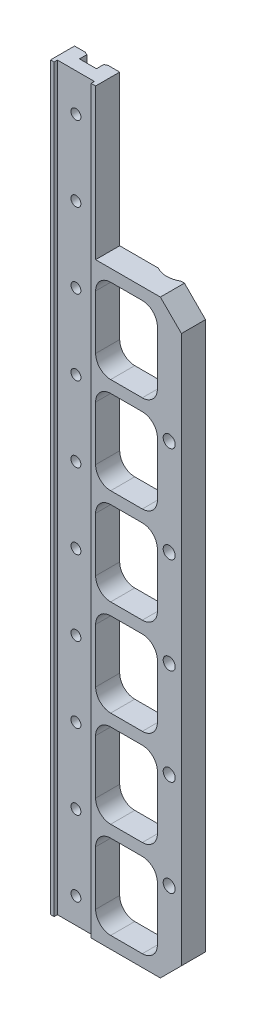
from build123d import *

# Parameters (mm, degrees)
BOSS_EXTRU_1_DEPTH         = 246
ENL_V_MAT_EXTRU_1_DEPTH    = 250.947352306
R_P_TITION_LIN_AIRE1_COUNT = 9
R_P_TITION_LIN_AIRE1_PITCH = 32
ESQUISSE3_R                = 1.65
ENL_V_MAT_EXTRU_2_DEPTH    = 250.914563254
ENL_V_START                = 4
ESQUISSE14_W               = 5.65
ESQUISSE14_H               = 25
ENL_V_MAT_EXTRU_8_DEPTH    = 246.914563352
R_P_TITION_LIN_AIRE4_COUNT = 10
R_P_TITION_LIN_AIRE4_PITCH = 25
ESQUISSE7_R                = 2
ENL_V_MAT_EXTRU_4_DEPTH    = 250.947352309
R_P_TITION_LIN_AIRE3_COUNT = 5
R_P_TITION_LIN_AIRE3_PITCH = 32
ESQUISSE12_W               = 28.516421325
ESQUISSE12_H               = 50
ENL_V_MAT_EXTRU_6_DEPTH    = 250.947352309
CHANFREIN1_SIZE            = 7


with BuildPart() as part:
    # Esquisse1 → Boss.-Extru.1 (new body)
    with BuildSketch(Plane(origin=(0, 0, 0), x_dir=(1, 0, 0), z_dir=(0, 1, 0))):
        with BuildLine():
            Line((0, -8.1), (0, -0.1))
            Line((0, -0.1), (-8.132842681, -0.1))
            ThreePointArc((-8.132842681, -0.1), (-11.916421325, -1.1), (-15.699999968, -0.1))
            Line((-15.699999968, -0.1), (-32.382842681, -0.1))
            ThreePointArc((-32.382842681, -0.1), (-36.166421325, -1.1), (-39.949999968, -0.1))
            Line((-39.949999968, -0.1), (-43.516421325, -0.1))
            Line((-43.516421325, -0.1), (-43.516421325, -8.1))
            Line((-43.516421325, -8.1), (-42.316421325, -8.1))
            Line((-42.316421325, -8.1), (-42.316421325, -7))
            Line((-42.316421325, -7), (-30.016421325, -7))
            Line((-30.016421325, -7), (-30.016421325, -8.1))
            Line((-30.016421325, -8.1), (0, -8.1))
        make_face()
    extrude(amount=BOSS_EXTRU_1_DEPTH)

    # Esquisse2 → Enlèv. mat.-Extru.1 (cut, through all)
    with BuildSketch(Plane(origin=(0, 0, 0.1), x_dir=(-1, 0, 0), z_dir=(0, 0, -1))):
        with BuildLine():
            Line((13, 4), (23.516421325, 4))
            ThreePointArc((23.516421325, 4), (27.05195523, 5.464466094), (28.516421325, 9))
            Line((28.516421325, 9), (28.516421325, 27))
            ThreePointArc((28.516421325, 27), (27.05195523, 30.535533906), (23.516421325, 32))
            Line((23.516421325, 32), (13, 32))
            ThreePointArc((13, 32), (9.464466094, 30.535533906), (8, 27))
            Line((8, 27), (8, 9))
            ThreePointArc((8, 9), (9.464466094, 5.464466094), (13, 4))
        make_face()
    enl_v_mat_extru_1 = extrude(amount=-ENL_V_MAT_EXTRU_1_DEPTH, mode=Mode.SUBTRACT)

    # Répétition linéaire1: Enlèv. mat.-Extru.1 ×9
    with Locations(*[(0, i * R_P_TITION_LIN_AIRE1_PITCH, 0) for i in range(1, R_P_TITION_LIN_AIRE1_COUNT)]):
        add(enl_v_mat_extru_1, mode=Mode.SUBTRACT)

    # Esquisse3 → Enlèv. mat.-Extru.2 (cut, through all)
    with BuildSketch(Plane.XY.offset(7)):
        with Locations((-36.166421325, 8.5)):
            Circle(ESQUISSE3_R)
    enl_v_mat_extru_2 = extrude(amount=-ENL_V_MAT_EXTRU_2_DEPTH, mode=Mode.SUBTRACT)

    # Esquisse14 → Enlèv. mat.-Extru.8 (cut, through all)
    with BuildSketch(Plane(origin=(0, 0, 7), x_dir=(-1, 0, 0), z_dir=(0, 0, -1)).offset(ENL_V_START)):
        with Locations((36.166421325, 8.5)):
            Rectangle(ESQUISSE14_W, ESQUISSE14_H)
    enl_v_mat_extru_8 = extrude(amount=ENL_V_MAT_EXTRU_8_DEPTH, mode=Mode.SUBTRACT)

    # Répétition linéaire4: Enlèv. mat.-Extru.2, Enlèv. mat.-Extru.8 ×10
    with Locations(*[(0, i * R_P_TITION_LIN_AIRE4_PITCH, 0) for i in range(1, R_P_TITION_LIN_AIRE4_COUNT)]):
        add(enl_v_mat_extru_2, mode=Mode.SUBTRACT)
        add(enl_v_mat_extru_8, mode=Mode.SUBTRACT)

    # Esquisse7 → Enlèv. mat.-Extru.4 (cut, through all)
    with BuildSketch(Plane(origin=(0, 0, 0.1), x_dir=(-1, 0, 0), z_dir=(0, 0, -1))):
        with Locations((4.06642134, 28)):
            Circle(ESQUISSE7_R)
    enl_v_mat_extru_4 = extrude(amount=-ENL_V_MAT_EXTRU_4_DEPTH, mode=Mode.SUBTRACT)

    # Répétition linéaire3: Enlèv. mat.-Extru.4 ×5
    with Locations(*[(0, i * R_P_TITION_LIN_AIRE3_PITCH, 0) for i in range(1, R_P_TITION_LIN_AIRE3_COUNT)]):
        add(enl_v_mat_extru_4, mode=Mode.SUBTRACT)

    # Esquisse12 → Enlèv. mat.-Extru.6 (cut, through all)
    with BuildSketch(Plane.XY.offset(8.1)):
        with Locations((-14.258210663, 221)):
            Rectangle(ESQUISSE12_W, ESQUISSE12_H)
    extrude(amount=-ENL_V_MAT_EXTRU_6_DEPTH, mode=Mode.SUBTRACT)

    # Chanfrein1
    chanfrein1_edges = [part.edges().sort_by_distance(p)[0] for p in [
        (0, 0, 4.1),
        (0, 196, 4.1),
    ]]
    chamfer(chanfrein1_edges, length=CHANFREIN1_SIZE)


solid = part.part
